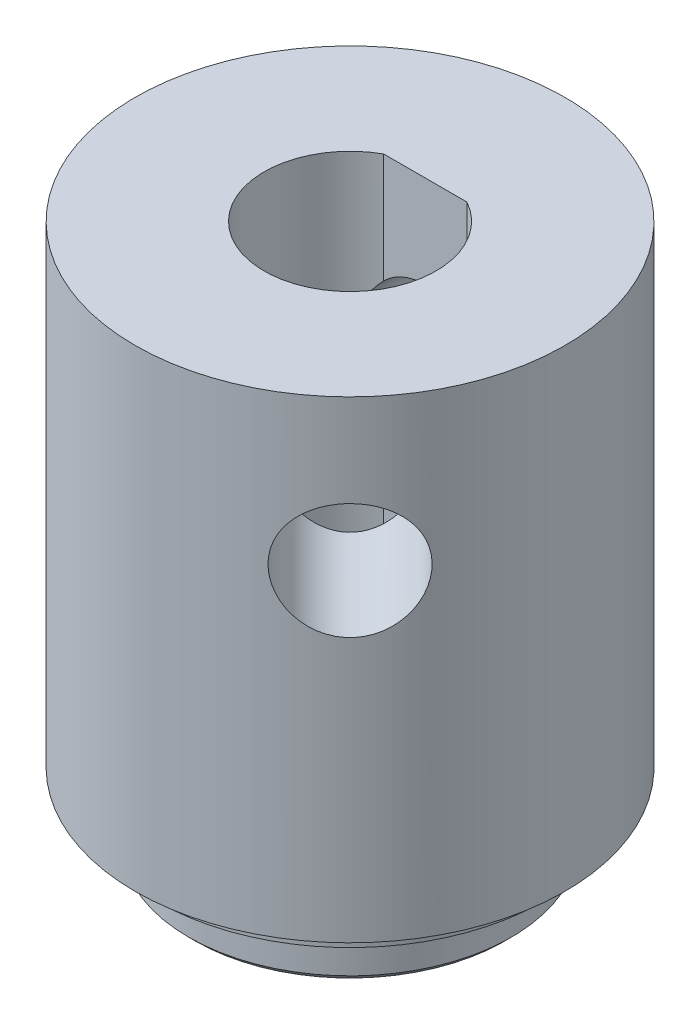
from build123d import *

# Parameters (mm, degrees)
SKETCH1_R             = 7.5
BOSS_EXTRUDE1_DEPTH   = 2.5
SKETCH2_R             = 9
BOSS_EXTRUDE2_DEPTH   = 0.9
SKETCH3_R             = 10
BOSS_EXTRUDE3_DEPTH   = 22
SKETCH5_R             = 2.7
CUT_EXTRUDE1_DEPTH    = 5.5
CUT_EXTRUDE2_DEPTH    = 19
SKETCH7_R             = 2.7
CUT_EXTRUDE3_DEPTH    = 30.071635661
CIRPATTERN1_START     = 2.951270805
CIRPATTERN1_OUTLINE_R = 2.7
CIRPATTERN1_DEPTH     = 7.048729295
CHAMFER1_SIZE         = 0.3


# Read off the part's stored shape, not the designer's step: CirPattern1
with BuildPart() as part:
    # Sketch1 → Boss-Extrude1 (new body)
    with BuildSketch(Plane(origin=(0, 0, 0), x_dir=(1, 0, 0), z_dir=(0, 1, 0))):
        with Locations(Location((0, 0, 0), (0, 0, 270))):
            Circle(SKETCH1_R)
    extrude(amount=BOSS_EXTRUDE1_DEPTH)

    # Sketch2 → Boss-Extrude2 (add)
    with BuildSketch(Plane(origin=(0, 2.5, 0), x_dir=(1, 0, 0), z_dir=(0, 1, 0))):
        with Locations(Location((0, 0, 0), (0, 0, 270))):
            Circle(SKETCH2_R)
    extrude(amount=BOSS_EXTRUDE2_DEPTH)

    # Sketch3 → Boss-Extrude3 (add)
    with BuildSketch(Plane(origin=(0, 3.4, 0), x_dir=(1, 0, 0), z_dir=(0, 1, 0))):
        with Locations(Location((0, 0, 0), (0, 0, 270))):
            Circle(SKETCH3_R)
    extrude(amount=BOSS_EXTRUDE3_DEPTH)

    # Sketch5 → Cut-Extrude1 (cut)
    with BuildSketch(Plane.XZ):
        with Locations(Location((3.6, 0, 0), (0, 0, 270))):
            Circle(SKETCH5_R)
        with Locations(Location((-3.6, 0, 0), (0, 0, 270))):
            Circle(SKETCH5_R)
    extrude(amount=-CUT_EXTRUDE1_DEPTH, mode=Mode.SUBTRACT)

    # Sketch6 → Cut-Extrude2 (cut)
    with BuildSketch(Plane(origin=(0, 25.4, 0), x_dir=(1, 0, 0), z_dir=(0, 1, 0))):
        with BuildLine():
            Line((-1.936491673, 3.5), (1.936491673, 3.5))
            ThreePointArc((1.936491673, 3.5), (0, -4), (-1.936491673, 3.5))
        make_face()
    extrude(amount=-CUT_EXTRUDE2_DEPTH, mode=Mode.SUBTRACT)

    # Sketch7 → Cut-Extrude3 (cut, through all)
    with BuildSketch(Plane.XY):
        with Locations(Location((0, 18.4, 0), (0, 0, 315.82536203))):
            Circle(SKETCH7_R)
    extrude(amount=-CUT_EXTRUDE3_DEPTH, mode=Mode.SUBTRACT)

    # CirPattern1 outline → CirPattern1 (cut)
    with BuildSketch(Plane(origin=(0, 0, 0), x_dir=(0.7071067811865509, 0, -0.707106781186544), z_dir=(0.707106781186544, 0, 0.707106781186551)).offset(CIRPATTERN1_START)):
        with Locations((0, 18.4)):
            Circle(CIRPATTERN1_OUTLINE_R)
    extrude(amount=CIRPATTERN1_DEPTH, mode=Mode.SUBTRACT)

    # Chamfer1
    chamfer1_edges = [part.edges().sort_by_distance(p)[0] for p in [
        (0, 0, -7.5),
    ]]
    chamfer(chamfer1_edges, length=CHAMFER1_SIZE)


solid = part.part
